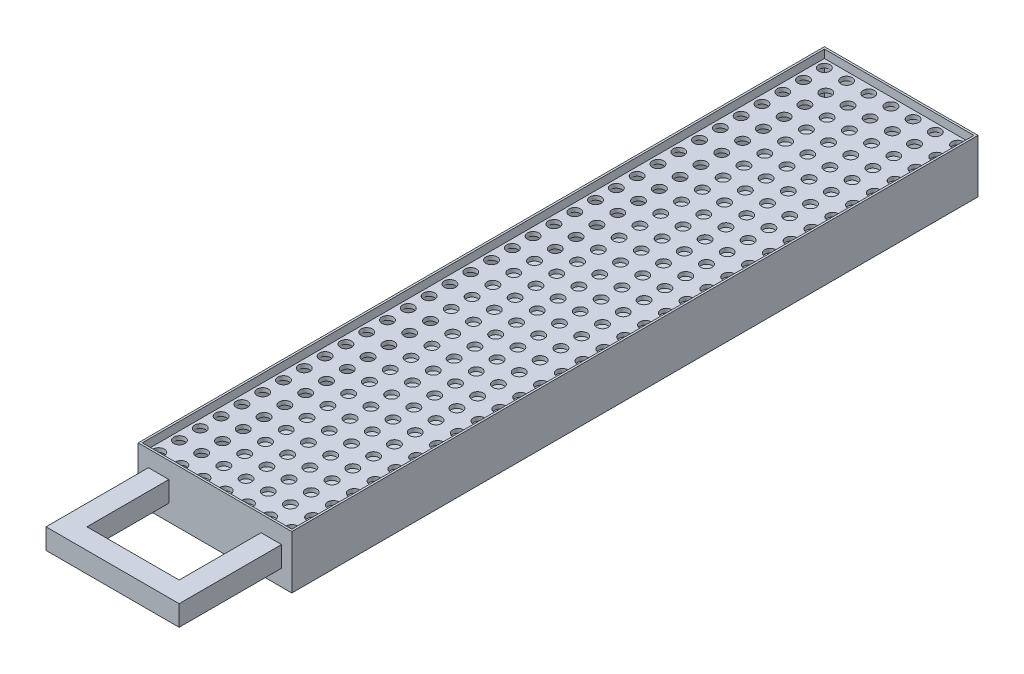
from build123d import *

# Parameters (mm, degrees)
CROQUIS1_W              = 75
CROQUIS1_H              = 335
SALIENTE_EXTRUIR1_DEPTH = 20
VACIADO1_T              = -2
CROQUIS2_R              = 2.75
CORTAR_EXTRUIR1_DEPTH   = 2
SALIENTE_EXTRUIR3_REACH = 185.808
CROQUIS3_W              = 45.255914356
CROQUIS3_H              = 5
CROQUIS4_W              = 75
CROQUIS4_H              = 335
SALIENTE_EXTRUIR5_DEPTH = 2
CROQUIS6_W              = 75
CROQUIS6_H              = 335
SALIENTE_EXTRUIR6_DEPTH = 4
CROQUIS9_W              = 73
CROQUIS9_H              = 333
CORTAR_EXTRUIR2_DEPTH   = 4
CORTAR_EXTRUIR3_REACH   = 175.604
CROQUIS10_R             = 5
CROQUIS11_W             = 10
CROQUIS11_H             = 10
SALIENTE_EXTRUIR7_DEPTH = 50
SALIENTE_EXTRUIR8_REACH = 228.897
CROQUIS12_W             = 10
CROQUIS12_H             = 10


with BuildPart() as part:
    # Croquis1 → Saliente-Extruir1 (new body)
    with BuildSketch(Plane(origin=(0, 0, 0), x_dir=(1, 0, 0), z_dir=(0, 1, 0))):
        Rectangle(CROQUIS1_W, CROQUIS1_H)
    extrude(amount=SALIENTE_EXTRUIR1_DEPTH)

    # Vaciado1
    vaciado1_openings = [part.faces().sort_by_distance(p)[0] for p in [
        (0, 0, 0),
    ]]
    offset(amount=VACIADO1_T, openings=vaciado1_openings, kind=Kind.INTERSECTION)

    # Croquis2 → Cortar-Extruir1 (cut)
    with BuildSketch(Plane(origin=(0, 20, 0), x_dir=(1, 0, 0), z_dir=(0, 1, 0))):
        with Locations(Location((32.5, 162.5, 0), (0, 0, 270))):
            Circle(CROQUIS2_R)
        with Locations(Location((32.5, 152.34375, 0), (0, 0, 270))):
            Circle(CROQUIS2_R)
        with Locations(Location((32.5, 142.1875, 0), (0, 0, 270))):
            Circle(CROQUIS2_R)
        with Locations(Location((32.5, 132.03125, 0), (0, 0, 270))):
            Circle(CROQUIS2_R)
        with Locations(Location((32.5, 121.875, 0), (0, 0, 270))):
            Circle(CROQUIS2_R)
        with Locations(Location((32.5, 111.71875, 0), (0, 0, 270))):
            Circle(CROQUIS2_R)
        with Locations(Location((32.5, 101.5625, 0), (0, 0, 270))):
            Circle(CROQUIS2_R)
        with Locations(Location((32.5, 91.40625, 0), (0, 0, 270))):
            Circle(CROQUIS2_R)
        with Locations(Location((32.5, 81.25, 0), (0, 0, 270))):
            Circle(CROQUIS2_R)
        with Locations(Location((32.5, 71.09375, 0), (0, 0, 270))):
            Circle(CROQUIS2_R)
        with Locations(Location((32.5, 60.9375, 0), (0, 0, 270))):
            Circle(CROQUIS2_R)
        with Locations(Location((32.5, 50.78125, 0), (0, 0, 270))):
            Circle(CROQUIS2_R)
        with Locations(Location((32.5, 40.625, 0), (0, 0, 270))):
            Circle(CROQUIS2_R)
        with Locations(Location((32.5, 30.46875, 0), (0, 0, 270))):
            Circle(CROQUIS2_R)
        with Locations(Location((32.5, 20.3125, 0), (0, 0, 270))):
            Circle(CROQUIS2_R)
        with Locations(Location((32.5, 10.15625, 0), (0, 0, 270))):
            Circle(CROQUIS2_R)
        with Locations(Location((32.5, 0, 0), (0, 0, 270))):
            Circle(CROQUIS2_R)
        with Locations(Location((32.5, -10.15625, 0), (0, 0, 270))):
            Circle(CROQUIS2_R)
        with Locations(Location((32.5, -20.3125, 0), (0, 0, 270))):
            Circle(CROQUIS2_R)
        with Locations(Location((32.5, -30.46875, 0), (0, 0, 270))):
            Circle(CROQUIS2_R)
        with Locations(Location((32.5, -40.625, 0), (0, 0, 270))):
            Circle(CROQUIS2_R)
        with Locations(Location((32.5, -50.78125, 0), (0, 0, 270))):
            Circle(CROQUIS2_R)
        with Locations(Location((32.5, -60.9375, 0), (0, 0, 270))):
            Circle(CROQUIS2_R)
        with Locations(Location((32.5, -71.09375, 0), (0, 0, 270))):
            Circle(CROQUIS2_R)
        with Locations(Location((32.5, -81.25, 0), (0, 0, 270))):
            Circle(CROQUIS2_R)
        with Locations(Location((32.5, -91.40625, 0), (0, 0, 270))):
            Circle(CROQUIS2_R)
        with Locations(Location((32.5, -101.5625, 0), (0, 0, 270))):
            Circle(CROQUIS2_R)
        with Locations(Location((32.5, -111.71875, 0), (0, 0, 270))):
            Circle(CROQUIS2_R)
        with Locations(Location((32.5, -121.875, 0), (0, 0, 270))):
            Circle(CROQUIS2_R)
        with Locations(Location((32.5, -132.03125, 0), (0, 0, 270))):
            Circle(CROQUIS2_R)
        with Locations(Location((32.5, -142.1875, 0), (0, 0, 270))):
            Circle(CROQUIS2_R)
        with Locations(Location((32.5, -152.34375, 0), (0, 0, 270))):
            Circle(CROQUIS2_R)
        with Locations(Location((32.5, -162.5, 0), (0, 0, 270))):
            Circle(CROQUIS2_R)
        with Locations(Location((21.666666667, 152.34375, 0), (0, 0, 270))):
            Circle(CROQUIS2_R)
        with Locations(Location((21.666666667, 142.1875, 0), (0, 0, 270))):
            Circle(CROQUIS2_R)
        with Locations(Location((21.666666667, 132.03125, 0), (0, 0, 270))):
            Circle(CROQUIS2_R)
        with Locations(Location((21.666666667, 121.875, 0), (0, 0, 270))):
            Circle(CROQUIS2_R)
        with Locations(Location((21.666666667, 111.71875, 0), (0, 0, 270))):
            Circle(CROQUIS2_R)
        with Locations(Location((21.666666667, 101.5625, 0), (0, 0, 270))):
            Circle(CROQUIS2_R)
        with Locations(Location((21.666666667, 91.40625, 0), (0, 0, 270))):
            Circle(CROQUIS2_R)
        with Locations(Location((21.666666667, 81.25, 0), (0, 0, 270))):
            Circle(CROQUIS2_R)
        with Locations(Location((21.666666667, 71.09375, 0), (0, 0, 270))):
            Circle(CROQUIS2_R)
        with Locations(Location((21.666666667, 60.9375, 0), (0, 0, 270))):
            Circle(CROQUIS2_R)
        with Locations(Location((21.666666667, 50.78125, 0), (0, 0, 270))):
            Circle(CROQUIS2_R)
        with Locations(Location((21.666666667, 40.625, 0), (0, 0, 270))):
            Circle(CROQUIS2_R)
        with Locations(Location((21.666666667, 30.46875, 0), (0, 0, 270))):
            Circle(CROQUIS2_R)
        with Locations(Location((21.666666667, 20.3125, 0), (0, 0, 270))):
            Circle(CROQUIS2_R)
        with Locations(Location((21.666666667, 10.15625, 0), (0, 0, 270))):
            Circle(CROQUIS2_R)
        with Locations(Location((21.666666667, 0, 0), (0, 0, 270))):
            Circle(CROQUIS2_R)
        with Locations(Location((21.666666667, -10.15625, 0), (0, 0, 270))):
            Circle(CROQUIS2_R)
        with Locations(Location((21.666666667, -20.3125, 0), (0, 0, 270))):
            Circle(CROQUIS2_R)
        with Locations(Location((21.666666667, -30.46875, 0), (0, 0, 270))):
            Circle(CROQUIS2_R)
        with Locations(Location((21.666666667, -40.625, 0), (0, 0, 270))):
            Circle(CROQUIS2_R)
        with Locations(Location((21.666666667, -50.78125, 0), (0, 0, 270))):
            Circle(CROQUIS2_R)
        with Locations(Location((21.666666667, -60.9375, 0), (0, 0, 270))):
            Circle(CROQUIS2_R)
        with Locations(Location((21.666666667, -71.09375, 0), (0, 0, 270))):
            Circle(CROQUIS2_R)
        with Locations(Location((21.666666667, -81.25, 0), (0, 0, 270))):
            Circle(CROQUIS2_R)
        with Locations(Location((21.666666667, -91.40625, 0), (0, 0, 270))):
            Circle(CROQUIS2_R)
        with Locations(Location((21.666666667, -101.5625, 0), (0, 0, 270))):
            Circle(CROQUIS2_R)
        with Locations(Location((21.666666667, -111.71875, 0), (0, 0, 270))):
            Circle(CROQUIS2_R)
        with Locations(Location((21.666666667, -121.875, 0), (0, 0, 270))):
            Circle(CROQUIS2_R)
        with Locations(Location((21.666666667, -132.03125, 0), (0, 0, 270))):
            Circle(CROQUIS2_R)
        with Locations(Location((21.666666667, -142.1875, 0), (0, 0, 270))):
            Circle(CROQUIS2_R)
        with Locations(Location((21.666666667, -152.34375, 0), (0, 0, 270))):
            Circle(CROQUIS2_R)
        with Locations(Location((21.666666667, -162.5, 0), (0, 0, 270))):
            Circle(CROQUIS2_R)
        with Locations(Location((10.833333333, 152.34375, 0), (0, 0, 270))):
            Circle(CROQUIS2_R)
        with Locations(Location((10.833333333, 142.1875, 0), (0, 0, 270))):
            Circle(CROQUIS2_R)
        with Locations(Location((10.833333333, 132.03125, 0), (0, 0, 270))):
            Circle(CROQUIS2_R)
        with Locations(Location((10.833333333, 121.875, 0), (0, 0, 270))):
            Circle(CROQUIS2_R)
        with Locations(Location((10.833333333, 111.71875, 0), (0, 0, 270))):
            Circle(CROQUIS2_R)
        with Locations(Location((10.833333333, 101.5625, 0), (0, 0, 270))):
            Circle(CROQUIS2_R)
        with Locations(Location((10.833333333, 91.40625, 0), (0, 0, 270))):
            Circle(CROQUIS2_R)
        with Locations(Location((10.833333333, 81.25, 0), (0, 0, 270))):
            Circle(CROQUIS2_R)
        with Locations(Location((10.833333333, 71.09375, 0), (0, 0, 270))):
            Circle(CROQUIS2_R)
        with Locations(Location((10.833333333, 60.9375, 0), (0, 0, 270))):
            Circle(CROQUIS2_R)
        with Locations(Location((10.833333333, 50.78125, 0), (0, 0, 270))):
            Circle(CROQUIS2_R)
        with Locations(Location((10.833333333, 40.625, 0), (0, 0, 270))):
            Circle(CROQUIS2_R)
        with Locations(Location((10.833333333, 30.46875, 0), (0, 0, 270))):
            Circle(CROQUIS2_R)
        with Locations(Location((10.833333333, 20.3125, 0), (0, 0, 270))):
            Circle(CROQUIS2_R)
        with Locations(Location((10.833333333, 10.15625, 0), (0, 0, 270))):
            Circle(CROQUIS2_R)
        with Locations(Location((10.833333333, 0, 0), (0, 0, 270))):
            Circle(CROQUIS2_R)
        with Locations(Location((10.833333333, -10.15625, 0), (0, 0, 270))):
            Circle(CROQUIS2_R)
        with Locations(Location((10.833333333, -20.3125, 0), (0, 0, 270))):
            Circle(CROQUIS2_R)
        with Locations(Location((10.833333333, -30.46875, 0), (0, 0, 270))):
            Circle(CROQUIS2_R)
        with Locations(Location((10.833333333, -40.625, 0), (0, 0, 270))):
            Circle(CROQUIS2_R)
        with Locations(Location((10.833333333, -50.78125, 0), (0, 0, 270))):
            Circle(CROQUIS2_R)
        with Locations(Location((10.833333333, -60.9375, 0), (0, 0, 270))):
            Circle(CROQUIS2_R)
        with Locations(Location((10.833333333, -71.09375, 0), (0, 0, 270))):
            Circle(CROQUIS2_R)
        with Locations(Location((10.833333333, -81.25, 0), (0, 0, 270))):
            Circle(CROQUIS2_R)
        with Locations(Location((10.833333333, -91.40625, 0), (0, 0, 270))):
            Circle(CROQUIS2_R)
        with Locations(Location((10.833333333, -101.5625, 0), (0, 0, 270))):
            Circle(CROQUIS2_R)
        with Locations(Location((10.833333333, -111.71875, 0), (0, 0, 270))):
            Circle(CROQUIS2_R)
        with Locations(Location((10.833333333, -121.875, 0), (0, 0, 270))):
            Circle(CROQUIS2_R)
        with Locations(Location((10.833333333, -132.03125, 0), (0, 0, 270))):
            Circle(CROQUIS2_R)
        with Locations(Location((10.833333333, -142.1875, 0), (0, 0, 270))):
            Circle(CROQUIS2_R)
        with Locations(Location((10.833333333, -152.34375, 0), (0, 0, 270))):
            Circle(CROQUIS2_R)
        with Locations(Location((10.833333333, -162.5, 0), (0, 0, 270))):
            Circle(CROQUIS2_R)
        with Locations(Location((0, 152.34375, 0), (0, 0, 270))):
            Circle(CROQUIS2_R)
        with Locations(Location((0, 142.1875, 0), (0, 0, 270))):
            Circle(CROQUIS2_R)
        with Locations(Location((0, 132.03125, 0), (0, 0, 270))):
            Circle(CROQUIS2_R)
        with Locations(Location((0, 121.875, 0), (0, 0, 270))):
            Circle(CROQUIS2_R)
        with Locations(Location((0, 111.71875, 0), (0, 0, 270))):
            Circle(CROQUIS2_R)
        with Locations(Location((0, 101.5625, 0), (0, 0, 270))):
            Circle(CROQUIS2_R)
        with Locations(Location((0, 91.40625, 0), (0, 0, 270))):
            Circle(CROQUIS2_R)
        with Locations(Location((0, 81.25, 0), (0, 0, 270))):
            Circle(CROQUIS2_R)
        with Locations(Location((0, 71.09375, 0), (0, 0, 270))):
            Circle(CROQUIS2_R)
        with Locations(Location((0, 60.9375, 0), (0, 0, 270))):
            Circle(CROQUIS2_R)
        with Locations(Location((0, 50.78125, 0), (0, 0, 270))):
            Circle(CROQUIS2_R)
        with Locations(Location((0, 40.625, 0), (0, 0, 270))):
            Circle(CROQUIS2_R)
        with Locations(Location((0, 30.46875, 0), (0, 0, 270))):
            Circle(CROQUIS2_R)
        with Locations(Location((0, 20.3125, 0), (0, 0, 270))):
            Circle(CROQUIS2_R)
        with Locations(Location((0, 10.15625, 0), (0, 0, 270))):
            Circle(CROQUIS2_R)
        with Locations(Location((0, 0, 0), (0, 0, 270))):
            Circle(CROQUIS2_R)
        with Locations(Location((0, -10.15625, 0), (0, 0, 270))):
            Circle(CROQUIS2_R)
        with Locations(Location((0, -20.3125, 0), (0, 0, 270))):
            Circle(CROQUIS2_R)
        with Locations(Location((0, -30.46875, 0), (0, 0, 270))):
            Circle(CROQUIS2_R)
        with Locations(Location((0, -40.625, 0), (0, 0, 270))):
            Circle(CROQUIS2_R)
        with Locations(Location((0, -50.78125, 0), (0, 0, 270))):
            Circle(CROQUIS2_R)
        with Locations(Location((0, -60.9375, 0), (0, 0, 270))):
            Circle(CROQUIS2_R)
        with Locations(Location((0, -71.09375, 0), (0, 0, 270))):
            Circle(CROQUIS2_R)
        with Locations(Location((0, -81.25, 0), (0, 0, 270))):
            Circle(CROQUIS2_R)
        with Locations(Location((0, -91.40625, 0), (0, 0, 270))):
            Circle(CROQUIS2_R)
        with Locations(Location((0, -101.5625, 0), (0, 0, 270))):
            Circle(CROQUIS2_R)
        with Locations(Location((0, -111.71875, 0), (0, 0, 270))):
            Circle(CROQUIS2_R)
        with Locations(Location((0, -121.875, 0), (0, 0, 270))):
            Circle(CROQUIS2_R)
        with Locations(Location((0, -132.03125, 0), (0, 0, 270))):
            Circle(CROQUIS2_R)
        with Locations(Location((0, -142.1875, 0), (0, 0, 270))):
            Circle(CROQUIS2_R)
        with Locations(Location((0, -152.34375, 0), (0, 0, 270))):
            Circle(CROQUIS2_R)
        with Locations(Location((0, -162.5, 0), (0, 0, 270))):
            Circle(CROQUIS2_R)
        with Locations(Location((-10.833333333, 152.34375, 0), (0, 0, 270))):
            Circle(CROQUIS2_R)
        with Locations(Location((-10.833333333, 142.1875, 0), (0, 0, 270))):
            Circle(CROQUIS2_R)
        with Locations(Location((-10.833333333, 132.03125, 0), (0, 0, 270))):
            Circle(CROQUIS2_R)
        with Locations(Location((-10.833333333, 121.875, 0), (0, 0, 270))):
            Circle(CROQUIS2_R)
        with Locations(Location((-10.833333333, 111.71875, 0), (0, 0, 270))):
            Circle(CROQUIS2_R)
        with Locations(Location((-10.833333333, 101.5625, 0), (0, 0, 270))):
            Circle(CROQUIS2_R)
        with Locations(Location((-10.833333333, 91.40625, 0), (0, 0, 270))):
            Circle(CROQUIS2_R)
        with Locations(Location((-10.833333333, 81.25, 0), (0, 0, 270))):
            Circle(CROQUIS2_R)
        with Locations(Location((-10.833333333, 71.09375, 0), (0, 0, 270))):
            Circle(CROQUIS2_R)
        with Locations(Location((-10.833333333, 60.9375, 0), (0, 0, 270))):
            Circle(CROQUIS2_R)
        with Locations(Location((-10.833333333, 50.78125, 0), (0, 0, 270))):
            Circle(CROQUIS2_R)
        with Locations(Location((-10.833333333, 40.625, 0), (0, 0, 270))):
            Circle(CROQUIS2_R)
        with Locations(Location((-10.833333333, 30.46875, 0), (0, 0, 270))):
            Circle(CROQUIS2_R)
        with Locations(Location((-10.833333333, 20.3125, 0), (0, 0, 270))):
            Circle(CROQUIS2_R)
        with Locations(Location((-10.833333333, 10.15625, 0), (0, 0, 270))):
            Circle(CROQUIS2_R)
        with Locations(Location((-10.833333333, 0, 0), (0, 0, 270))):
            Circle(CROQUIS2_R)
        with Locations(Location((-10.833333333, -10.15625, 0), (0, 0, 270))):
            Circle(CROQUIS2_R)
        with Locations(Location((-10.833333333, -20.3125, 0), (0, 0, 270))):
            Circle(CROQUIS2_R)
        with Locations(Location((-10.833333333, -30.46875, 0), (0, 0, 270))):
            Circle(CROQUIS2_R)
        with Locations(Location((-10.833333333, -40.625, 0), (0, 0, 270))):
            Circle(CROQUIS2_R)
        with Locations(Location((-10.833333333, -50.78125, 0), (0, 0, 270))):
            Circle(CROQUIS2_R)
        with Locations(Location((-10.833333333, -60.9375, 0), (0, 0, 270))):
            Circle(CROQUIS2_R)
        with Locations(Location((-10.833333333, -71.09375, 0), (0, 0, 270))):
            Circle(CROQUIS2_R)
        with Locations(Location((-10.833333333, -81.25, 0), (0, 0, 270))):
            Circle(CROQUIS2_R)
        with Locations(Location((-10.833333333, -91.40625, 0), (0, 0, 270))):
            Circle(CROQUIS2_R)
        with Locations(Location((-10.833333333, -101.5625, 0), (0, 0, 270))):
            Circle(CROQUIS2_R)
        with Locations(Location((-10.833333333, -111.71875, 0), (0, 0, 270))):
            Circle(CROQUIS2_R)
        with Locations(Location((-10.833333333, -121.875, 0), (0, 0, 270))):
            Circle(CROQUIS2_R)
        with Locations(Location((-10.833333333, -132.03125, 0), (0, 0, 270))):
            Circle(CROQUIS2_R)
        with Locations(Location((-10.833333333, -142.1875, 0), (0, 0, 270))):
            Circle(CROQUIS2_R)
        with Locations(Location((-10.833333333, -152.34375, 0), (0, 0, 270))):
            Circle(CROQUIS2_R)
        with Locations(Location((-10.833333333, -162.5, 0), (0, 0, 270))):
            Circle(CROQUIS2_R)
        with Locations(Location((-21.666666667, 152.34375, 0), (0, 0, 270))):
            Circle(CROQUIS2_R)
        with Locations(Location((-21.666666667, 142.1875, 0), (0, 0, 270))):
            Circle(CROQUIS2_R)
        with Locations(Location((-21.666666667, 132.03125, 0), (0, 0, 270))):
            Circle(CROQUIS2_R)
        with Locations(Location((-21.666666667, 121.875, 0), (0, 0, 270))):
            Circle(CROQUIS2_R)
        with Locations(Location((-21.666666667, 111.71875, 0), (0, 0, 270))):
            Circle(CROQUIS2_R)
        with Locations(Location((-21.666666667, 101.5625, 0), (0, 0, 270))):
            Circle(CROQUIS2_R)
        with Locations(Location((-21.666666667, 91.40625, 0), (0, 0, 270))):
            Circle(CROQUIS2_R)
        with Locations(Location((-21.666666667, 81.25, 0), (0, 0, 270))):
            Circle(CROQUIS2_R)
        with Locations(Location((-21.666666667, 71.09375, 0), (0, 0, 270))):
            Circle(CROQUIS2_R)
        with Locations(Location((-21.666666667, 60.9375, 0), (0, 0, 270))):
            Circle(CROQUIS2_R)
        with Locations(Location((-21.666666667, 50.78125, 0), (0, 0, 270))):
            Circle(CROQUIS2_R)
        with Locations(Location((-21.666666667, 40.625, 0), (0, 0, 270))):
            Circle(CROQUIS2_R)
        with Locations(Location((-21.666666667, 30.46875, 0), (0, 0, 270))):
            Circle(CROQUIS2_R)
        with Locations(Location((-21.666666667, 20.3125, 0), (0, 0, 270))):
            Circle(CROQUIS2_R)
        with Locations(Location((-21.666666667, 10.15625, 0), (0, 0, 270))):
            Circle(CROQUIS2_R)
        with Locations(Location((-21.666666667, 0, 0), (0, 0, 270))):
            Circle(CROQUIS2_R)
        with Locations(Location((-21.666666667, -10.15625, 0), (0, 0, 270))):
            Circle(CROQUIS2_R)
        with Locations(Location((-21.666666667, -20.3125, 0), (0, 0, 270))):
            Circle(CROQUIS2_R)
        with Locations(Location((-21.666666667, -30.46875, 0), (0, 0, 270))):
            Circle(CROQUIS2_R)
        with Locations(Location((-21.666666667, -40.625, 0), (0, 0, 270))):
            Circle(CROQUIS2_R)
        with Locations(Location((-21.666666667, -50.78125, 0), (0, 0, 270))):
            Circle(CROQUIS2_R)
        with Locations(Location((-21.666666667, -60.9375, 0), (0, 0, 270))):
            Circle(CROQUIS2_R)
        with Locations(Location((-21.666666667, -71.09375, 0), (0, 0, 270))):
            Circle(CROQUIS2_R)
        with Locations(Location((-21.666666667, -81.25, 0), (0, 0, 270))):
            Circle(CROQUIS2_R)
        with Locations(Location((-21.666666667, -91.40625, 0), (0, 0, 270))):
            Circle(CROQUIS2_R)
        with Locations(Location((-21.666666667, -101.5625, 0), (0, 0, 270))):
            Circle(CROQUIS2_R)
        with Locations(Location((-21.666666667, -111.71875, 0), (0, 0, 270))):
            Circle(CROQUIS2_R)
        with Locations(Location((-21.666666667, -121.875, 0), (0, 0, 270))):
            Circle(CROQUIS2_R)
        with Locations(Location((-21.666666667, -132.03125, 0), (0, 0, 270))):
            Circle(CROQUIS2_R)
        with Locations(Location((-21.666666667, -142.1875, 0), (0, 0, 270))):
            Circle(CROQUIS2_R)
        with Locations(Location((-21.666666667, -152.34375, 0), (0, 0, 270))):
            Circle(CROQUIS2_R)
        with Locations(Location((-21.666666667, -162.5, 0), (0, 0, 270))):
            Circle(CROQUIS2_R)
        with Locations(Location((-32.5, 152.34375, 0), (0, 0, 270))):
            Circle(CROQUIS2_R)
        with Locations(Location((-32.5, 142.1875, 0), (0, 0, 270))):
            Circle(CROQUIS2_R)
        with Locations(Location((-32.5, 132.03125, 0), (0, 0, 270))):
            Circle(CROQUIS2_R)
        with Locations(Location((-32.5, 121.875, 0), (0, 0, 270))):
            Circle(CROQUIS2_R)
        with Locations(Location((-32.5, 111.71875, 0), (0, 0, 270))):
            Circle(CROQUIS2_R)
        with Locations(Location((-32.5, 101.5625, 0), (0, 0, 270))):
            Circle(CROQUIS2_R)
        with Locations(Location((-32.5, 91.40625, 0), (0, 0, 270))):
            Circle(CROQUIS2_R)
        with Locations(Location((-32.5, 81.25, 0), (0, 0, 270))):
            Circle(CROQUIS2_R)
        with Locations(Location((-32.5, 71.09375, 0), (0, 0, 270))):
            Circle(CROQUIS2_R)
        with Locations(Location((-32.5, 60.9375, 0), (0, 0, 270))):
            Circle(CROQUIS2_R)
        with Locations(Location((-32.5, 50.78125, 0), (0, 0, 270))):
            Circle(CROQUIS2_R)
        with Locations(Location((-32.5, 40.625, 0), (0, 0, 270))):
            Circle(CROQUIS2_R)
        with Locations(Location((-32.5, 30.46875, 0), (0, 0, 270))):
            Circle(CROQUIS2_R)
        with Locations(Location((-32.5, 20.3125, 0), (0, 0, 270))):
            Circle(CROQUIS2_R)
        with Locations(Location((-32.5, 10.15625, 0), (0, 0, 270))):
            Circle(CROQUIS2_R)
        with Locations(Location((-32.5, 0, 0), (0, 0, 270))):
            Circle(CROQUIS2_R)
        with Locations(Location((-32.5, -10.15625, 0), (0, 0, 270))):
            Circle(CROQUIS2_R)
        with Locations(Location((-32.5, -20.3125, 0), (0, 0, 270))):
            Circle(CROQUIS2_R)
        with Locations(Location((-32.5, -30.46875, 0), (0, 0, 270))):
            Circle(CROQUIS2_R)
        with Locations(Location((-32.5, -40.625, 0), (0, 0, 270))):
            Circle(CROQUIS2_R)
        with Locations(Location((-32.5, -50.78125, 0), (0, 0, 270))):
            Circle(CROQUIS2_R)
        with Locations(Location((-32.5, -60.9375, 0), (0, 0, 270))):
            Circle(CROQUIS2_R)
        with Locations(Location((-32.5, -71.09375, 0), (0, 0, 270))):
            Circle(CROQUIS2_R)
        with Locations(Location((-32.5, -81.25, 0), (0, 0, 270))):
            Circle(CROQUIS2_R)
        with Locations(Location((-32.5, -91.40625, 0), (0, 0, 270))):
            Circle(CROQUIS2_R)
        with Locations(Location((-32.5, -101.5625, 0), (0, 0, 270))):
            Circle(CROQUIS2_R)
        with Locations(Location((-32.5, -111.71875, 0), (0, 0, 270))):
            Circle(CROQUIS2_R)
        with Locations(Location((-32.5, -121.875, 0), (0, 0, 270))):
            Circle(CROQUIS2_R)
        with Locations(Location((-32.5, -132.03125, 0), (0, 0, 270))):
            Circle(CROQUIS2_R)
        with Locations(Location((-32.5, -142.1875, 0), (0, 0, 270))):
            Circle(CROQUIS2_R)
        with Locations(Location((-32.5, -152.34375, 0), (0, 0, 270))):
            Circle(CROQUIS2_R)
        with Locations(Location((-32.5, -162.5, 0), (0, 0, 270))):
            Circle(CROQUIS2_R)
        with Locations(Location((21.666666667, 162.5, 0), (0, 0, 270))):
            Circle(CROQUIS2_R)
        with Locations(Location((10.833333333, 162.5, 0), (0, 0, 270))):
            Circle(CROQUIS2_R)
        with Locations(Location((0, 162.5, 0), (0, 0, 270))):
            Circle(CROQUIS2_R)
        with Locations(Location((-10.833333333, 162.5, 0), (0, 0, 270))):
            Circle(CROQUIS2_R)
        with Locations(Location((-21.666666667, 162.5, 0), (0, 0, 270))):
            Circle(CROQUIS2_R)
        with Locations(Location((-32.5, 162.5, 0), (0, 0, 270))):
            Circle(CROQUIS2_R)
    extrude(amount=-CORTAR_EXTRUIR1_DEPTH, mode=Mode.SUBTRACT)

    # Croquis3 → Saliente-Extruir3 (add, up to next)
    with BuildSketch(Plane.ZY.offset(-35.5), mode=Mode.PRIVATE) as saliente_extruir3_sk1:
        with Locations((-0.372042822, 5.5)):
            Rectangle(CROQUIS3_W, CROQUIS3_H)
    saliente_extruir3_tool1 = extrude(saliente_extruir3_sk1.sketch, amount=SALIENTE_EXTRUIR3_REACH, mode=Mode.PRIVATE) - part.part
    add(saliente_extruir3_tool1.solids().sort_by_distance((35.5, 5.5, -0.372043))[0])

    # Croquis4 → Saliente-Extruir5 (add)
    with BuildSketch(Plane.XZ):
        Rectangle(CROQUIS4_W, CROQUIS4_H)
    extrude(amount=SALIENTE_EXTRUIR5_DEPTH)

    # Croquis6 → Saliente-Extruir6 (add)
    with BuildSketch(Plane(origin=(0, 20, 0), x_dir=(1, 0, 0), z_dir=(0, 1, 0))):
        Rectangle(CROQUIS6_W, CROQUIS6_H)
    extrude(amount=SALIENTE_EXTRUIR6_DEPTH)

    # Croquis9 → Cortar-Extruir2 (cut)
    with BuildSketch(Plane(origin=(0, 24, 0), x_dir=(1, 0, 0), z_dir=(0, 1, 0))):
        Rectangle(CROQUIS9_W, CROQUIS9_H)
    extrude(amount=-CORTAR_EXTRUIR2_DEPTH, mode=Mode.SUBTRACT)

    # Croquis10 → Cortar-Extruir3 (cut, up to next)
    with BuildSketch(Plane.XZ.offset(2), mode=Mode.PRIVATE) as cortar_extruir3_sk1:
        with Locations(Location((-29.5, 159.5, 0), (0, 0, 270))):
            Circle(CROQUIS10_R)
    cortar_extruir3_tool1 = extrude(cortar_extruir3_sk1.sketch, amount=-CORTAR_EXTRUIR3_REACH, mode=Mode.PRIVATE) & part.part
    add(cortar_extruir3_tool1.solids().sort_by_distance((-29.5, -2, 159.5))[0], mode=Mode.SUBTRACT)

    # Croquis11 → Saliente-Extruir7 (add)
    with BuildSketch(Plane.XY.offset(167.5)):
        with Locations((27.5, 11)):
            Rectangle(CROQUIS11_W, CROQUIS11_H)
        with Locations((-27.5, 11)):
            Rectangle(CROQUIS11_W, CROQUIS11_H)
    extrude(amount=SALIENTE_EXTRUIR7_DEPTH)

    # Croquis12 → Saliente-Extruir8 (add, up to next)
    with BuildSketch(Plane(origin=(-22.5, 0, 0), x_dir=(0, 0, -1), z_dir=(1, 0, 0)), mode=Mode.PRIVATE) as saliente_extruir8_sk1:
        with Locations((-212.5, 11)):
            Rectangle(CROQUIS12_W, CROQUIS12_H)
    saliente_extruir8_tool1 = extrude(saliente_extruir8_sk1.sketch, amount=SALIENTE_EXTRUIR8_REACH, mode=Mode.PRIVATE) - part.part
    add(saliente_extruir8_tool1.solids().sort_by_distance((-22.5, 11, 212.5))[0])


solid = part.part
